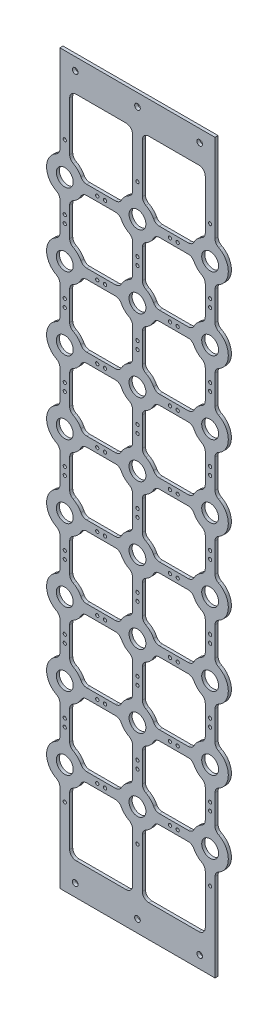
from build123d import *

# Parameters (mm, degrees)
SKETCH1_W           = 282
SKETCH1_H           = 1122
BOSS_EXTRUDE1_DEPTH = 4.7625
CUT_EXTRUDE1_DEPTH  = 579.467528394
CUT_EXTRUDE2_DEPTH  = 579.467528394
CUT_EXTRUDE3_DEPTH  = 579.467528394
CUT_EXTRUDE4_DEPTH  = 579.467528394
CUT_EXTRUDE5_DEPTH  = 579.467528394
CUT_EXTRUDE6_DEPTH  = 579.467528394
CUT_EXTRUDE7_DEPTH  = 579.467528394
CUT_EXTRUDE8_DEPTH  = 579.467528394
CUT_EXTRUDE9_DEPTH  = 579.467528394
CUT_EXTRUDE10_DEPTH = 579.467528394
CUT_EXTRUDE11_DEPTH = 579.467528394
CUT_EXTRUDE12_DEPTH = 579.467528394
CUT_EXTRUDE13_DEPTH = 579.467528394
CUT_EXTRUDE14_DEPTH = 579.467528394
CUT_EXTRUDE15_DEPTH = 579.467528394
CUT_EXTRUDE16_DEPTH = 579.467528394
CUT_EXTRUDE17_DEPTH = 579.467528394
CUT_EXTRUDE18_DEPTH = 579.467528394
CUT_EXTRUDE19_DEPTH = 579.467528394
CUT_EXTRUDE20_DEPTH = 579.467528394
FILLET1_R           = 10
SKETCH26_R          = 2.4892
CUT_EXTRUDE21_DEPTH = 10
SKETCH28_R          = 13
CUT_EXTRUDE23_DEPTH = 10
SKETCH27_R          = 4.3688
CUT_EXTRUDE22_DEPTH = 579.467528394
CUT_EXTRUDE24_DEPTH = 10
CUT_EXTRUDE25_DEPTH = 10


with BuildPart() as part:
    # Sketch1 → Boss-Extrude1 (new body)
    with BuildSketch(Plane.XY.offset(1.5875)):
        Rectangle(SKETCH1_W, SKETCH1_H)
    extrude(amount=-BOSS_EXTRUDE1_DEPTH)

    # Sketch2 → Cut-Extrude1 (cut, through all)
    with BuildSketch(Plane(origin=(0, 0, -3.175), x_dir=(-1, 0, 0), z_dir=(0, 0, -1))):
        with BuildLine():
            Line((141, 511.5), (119.5, 511.5))
            Line((119.5, 511.5), (119.5, 418.98722105))
            ThreePointArc((119.5, 418.98722105), (140.01, 392), (119.5, 365.01277895))
            Line((119.5, 365.01277895), (119.5, 306.98722105))
            ThreePointArc((119.5, 306.98722105), (140.01, 280), (119.5, 253.01277895))
            Line((119.5, 253.01277895), (119.5, 194.98722105))
            ThreePointArc((119.5, 194.98722105), (140.01, 168), (119.5, 141.01277895))
            Line((119.5, 141.01277895), (119.5, 82.98722105))
            ThreePointArc((119.5, 82.98722105), (140.01, 56), (119.5, 29.01277895))
            Line((119.5, 29.01277895), (119.5, -29.01277895))
            ThreePointArc((119.5, -29.01277895), (140.01, -56), (119.5, -82.98722105))
            Line((119.5, -82.98722105), (119.5, -141.01277895))
            ThreePointArc((119.5, -141.01277895), (140.01, -168), (119.5, -194.98722105))
            Line((119.5, -194.98722105), (119.5, -253.01277895))
            ThreePointArc((119.5, -253.01277895), (140.01, -280), (119.5, -306.98722105))
            Line((119.5, -306.98722105), (119.5, -365.01277895))
            ThreePointArc((119.5, -365.01277895), (140.01, -392), (119.5, -418.98722105))
            Line((119.5, -418.98722105), (119.5, -511.5))
            Line((119.5, -511.5), (141, -511.5))
            Line((141, -511.5), (141, 511.5))
        make_face()
    extrude(amount=-CUT_EXTRUDE1_DEPTH, mode=Mode.SUBTRACT)

    # Sketch3 → Cut-Extrude2 (cut, through all)
    with BuildSketch(Plane(origin=(0, 0, -3.175), x_dir=(-1, 0, 0), z_dir=(0, 0, -1))):
        with BuildLine():
            Line((-141, 511.5), (-141, -511.5))
            Line((-141, -511.5), (-119.5, -511.5))
            Line((-119.5, -511.5), (-119.5, -418.98722105))
            ThreePointArc((-119.5, -418.98722105), (-140.01, -392), (-119.5, -365.01277895))
            Line((-119.5, -365.01277895), (-119.5, -306.98722105))
            ThreePointArc((-119.5, -306.98722105), (-140.01, -280), (-119.5, -253.01277895))
            Line((-119.5, -253.01277895), (-119.5, -194.98722105))
            ThreePointArc((-119.5, -194.98722105), (-140.01, -168), (-119.5, -141.01277895))
            Line((-119.5, -141.01277895), (-119.5, -82.98722105))
            ThreePointArc((-119.5, -82.98722105), (-140.01, -56), (-119.5, -29.01277895))
            Line((-119.5, -29.01277895), (-119.5, 29.01277895))
            ThreePointArc((-119.5, 29.01277895), (-140.01, 56), (-119.5, 82.98722105))
            Line((-119.5, 82.98722105), (-119.5, 141.01277895))
            ThreePointArc((-119.5, 141.01277895), (-140.01, 168), (-119.5, 194.98722105))
            Line((-119.5, 194.98722105), (-119.5, 253.01277895))
            ThreePointArc((-119.5, 253.01277895), (-140.01, 280), (-119.5, 306.98722105))
            Line((-119.5, 306.98722105), (-119.5, 365.01277895))
            ThreePointArc((-119.5, 365.01277895), (-140.01, 392), (-119.5, 418.98722105))
            Line((-119.5, 418.98722105), (-119.5, 511.5))
            Line((-119.5, 511.5), (-141, 511.5))
        make_face()
    extrude(amount=-CUT_EXTRUDE2_DEPTH, mode=Mode.SUBTRACT)

    # Sketch4 → Cut-Extrude3 (cut, through all)
    with BuildSketch(Plane.XY.offset(1.5875)):
        with BuildLine():
            Line((-26.98722105, -399.5), (-85.01277895, -399.5))
            ThreePointArc((-85.01277895, -399.5), (-92.193939059, -411.806060941), (-104.5, -418.98722105))
            Line((-104.5, -418.98722105), (-104.5, -511.5))
            Line((-104.5, -511.5), (-7.5, -511.5))
            Line((-7.5, -511.5), (-7.5, -418.98722105))
            ThreePointArc((-7.5, -418.98722105), (-19.806060941, -411.806060941), (-26.98722105, -399.5))
        make_face()
    extrude(amount=-CUT_EXTRUDE3_DEPTH, mode=Mode.SUBTRACT)

    # Sketch5 → Cut-Extrude4 (cut, through all)
    with BuildSketch(Plane.XY.offset(1.5875)):
        with BuildLine():
            Line((-85.01277895, 287.5), (-26.98722105, 287.5))
            ThreePointArc((-26.98722105, 287.5), (-19.806060941, 299.806060941), (-7.5, 306.98722105))
            Line((-7.5, 306.98722105), (-7.5, 365.01277895))
            ThreePointArc((-7.5, 365.01277895), (-19.806060941, 372.193939059), (-26.98722105, 384.5))
            Line((-26.98722105, 384.5), (-85.01277895, 384.5))
            ThreePointArc((-85.01277895, 384.5), (-92.193939059, 372.193939059), (-104.5, 365.01277895))
            Line((-104.5, 365.01277895), (-104.5, 306.98722105))
            ThreePointArc((-104.5, 306.98722105), (-92.193939059, 299.806060941), (-85.01277895, 287.5))
        make_face()
    extrude(amount=-CUT_EXTRUDE4_DEPTH, mode=Mode.SUBTRACT)

    # Sketch6 → Cut-Extrude5 (cut, through all)
    with BuildSketch(Plane.XY.offset(1.5875)):
        with BuildLine():
            Line((26.98722105, -384.5), (85.01277895, -384.5))
            ThreePointArc((85.01277895, -384.5), (92.193939059, -372.193939059), (104.5, -365.01277895))
            Line((104.5, -365.01277895), (104.5, -306.98722105))
            ThreePointArc((104.5, -306.98722105), (92.193939059, -299.806060941), (85.01277895, -287.5))
            Line((85.01277895, -287.5), (26.98722105, -287.5))
            ThreePointArc((26.98722105, -287.5), (19.806060941, -299.806060941), (7.5, -306.98722105))
            Line((7.5, -306.98722105), (7.5, -365.01277895))
            ThreePointArc((7.5, -365.01277895), (19.806060941, -372.193939059), (26.98722105, -384.5))
        make_face()
    extrude(amount=-CUT_EXTRUDE5_DEPTH, mode=Mode.SUBTRACT)

    # Sketch7 → Cut-Extrude6 (cut, through all)
    with BuildSketch(Plane.XY.offset(1.5875)):
        with BuildLine():
            Line((26.98722105, -272.5), (85.01277895, -272.5))
            ThreePointArc((85.01277895, -272.5), (92.193939059, -260.193939059), (104.5, -253.01277895))
            Line((104.5, -253.01277895), (104.5, -194.98722105))
            ThreePointArc((104.5, -194.98722105), (92.193939059, -187.806060941), (85.01277895, -175.5))
            Line((85.01277895, -175.5), (26.98722105, -175.5))
            ThreePointArc((26.98722105, -175.5), (19.806060941, -187.806060941), (7.5, -194.98722105))
            Line((7.5, -194.98722105), (7.5, -253.01277895))
            ThreePointArc((7.5, -253.01277895), (19.806060941, -260.193939059), (26.98722105, -272.5))
        make_face()
    extrude(amount=-CUT_EXTRUDE6_DEPTH, mode=Mode.SUBTRACT)

    # Sketch8 → Cut-Extrude7 (cut, through all)
    with BuildSketch(Plane.XY.offset(1.5875)):
        with BuildLine():
            Line((26.98722105, -160.5), (85.01277895, -160.5))
            ThreePointArc((85.01277895, -160.5), (92.193939059, -148.193939059), (104.5, -141.01277895))
            Line((104.5, -141.01277895), (104.5, -82.98722105))
            ThreePointArc((104.5, -82.98722105), (92.193939059, -75.806060941), (85.01277895, -63.5))
            Line((85.01277895, -63.5), (26.98722105, -63.5))
            ThreePointArc((26.98722105, -63.5), (19.806060941, -75.806060941), (7.5, -82.98722105))
            Line((7.5, -82.98722105), (7.5, -141.01277895))
            ThreePointArc((7.5, -141.01277895), (19.806060941, -148.193939059), (26.98722105, -160.5))
        make_face()
    extrude(amount=-CUT_EXTRUDE7_DEPTH, mode=Mode.SUBTRACT)

    # Sketch9 → Cut-Extrude8 (cut, through all)
    with BuildSketch(Plane.XY.offset(1.5875)):
        with BuildLine():
            Line((-85.01277895, 175.5), (-26.98722105, 175.5))
            ThreePointArc((-26.98722105, 175.5), (-19.806060941, 187.806060941), (-7.5, 194.98722105))
            Line((-7.5, 194.98722105), (-7.5, 253.01277895))
            ThreePointArc((-7.5, 253.01277895), (-19.806060941, 260.193939059), (-26.98722105, 272.5))
            Line((-26.98722105, 272.5), (-85.01277895, 272.5))
            ThreePointArc((-85.01277895, 272.5), (-92.193939059, 260.193939059), (-104.5, 253.01277895))
            Line((-104.5, 253.01277895), (-104.5, 194.98722105))
            ThreePointArc((-104.5, 194.98722105), (-92.193939059, 187.806060941), (-85.01277895, 175.5))
        make_face()
    extrude(amount=-CUT_EXTRUDE8_DEPTH, mode=Mode.SUBTRACT)

    # Sketch10 → Cut-Extrude9 (cut, through all)
    with BuildSketch(Plane.XY.offset(1.5875)):
        with BuildLine():
            Line((-85.01277895, 63.5), (-26.98722105, 63.5))
            ThreePointArc((-26.98722105, 63.5), (-19.806060941, 75.806060941), (-7.5, 82.98722105))
            Line((-7.5, 82.98722105), (-7.5, 141.01277895))
            ThreePointArc((-7.5, 141.01277895), (-19.806060941, 148.193939059), (-26.98722105, 160.5))
            Line((-26.98722105, 160.5), (-85.01277895, 160.5))
            ThreePointArc((-85.01277895, 160.5), (-92.193939059, 148.193939059), (-104.5, 141.01277895))
            Line((-104.5, 141.01277895), (-104.5, 82.98722105))
            ThreePointArc((-104.5, 82.98722105), (-92.193939059, 75.806060941), (-85.01277895, 63.5))
        make_face()
    extrude(amount=-CUT_EXTRUDE9_DEPTH, mode=Mode.SUBTRACT)

    # Sketch11 → Cut-Extrude10 (cut, through all)
    with BuildSketch(Plane.XY.offset(1.5875)):
        with BuildLine():
            Line((-85.01277895, -48.5), (-26.98722105, -48.5))
            ThreePointArc((-26.98722105, -48.5), (-19.806060941, -36.193939059), (-7.5, -29.01277895))
            Line((-7.5, -29.01277895), (-7.5, 29.01277895))
            ThreePointArc((-7.5, 29.01277895), (-19.806060941, 36.193939059), (-26.98722105, 48.5))
            Line((-26.98722105, 48.5), (-85.01277895, 48.5))
            ThreePointArc((-85.01277895, 48.5), (-92.193939059, 36.193939059), (-104.5, 29.01277895))
            Line((-104.5, 29.01277895), (-104.5, -29.01277895))
            ThreePointArc((-104.5, -29.01277895), (-92.193939059, -36.193939059), (-85.01277895, -48.5))
        make_face()
    extrude(amount=-CUT_EXTRUDE10_DEPTH, mode=Mode.SUBTRACT)

    # Sketch12 → Cut-Extrude11 (cut, through all)
    with BuildSketch(Plane.XY.offset(1.5875)):
        with BuildLine():
            Line((-85.01277895, -160.5), (-26.98722105, -160.5))
            ThreePointArc((-26.98722105, -160.5), (-19.806060941, -148.193939059), (-7.5, -141.01277895))
            Line((-7.5, -141.01277895), (-7.5, -82.98722105))
            ThreePointArc((-7.5, -82.98722105), (-19.806060941, -75.806060941), (-26.98722105, -63.5))
            Line((-26.98722105, -63.5), (-85.01277895, -63.5))
            ThreePointArc((-85.01277895, -63.5), (-92.193939059, -75.806060941), (-104.5, -82.98722105))
            Line((-104.5, -82.98722105), (-104.5, -141.01277895))
            ThreePointArc((-104.5, -141.01277895), (-92.193939059, -148.193939059), (-85.01277895, -160.5))
        make_face()
    extrude(amount=-CUT_EXTRUDE11_DEPTH, mode=Mode.SUBTRACT)

    # Sketch13 → Cut-Extrude12 (cut, through all)
    with BuildSketch(Plane.XY.offset(1.5875)):
        with BuildLine():
            Line((26.98722105, -48.5), (85.01277895, -48.5))
            ThreePointArc((85.01277895, -48.5), (92.193939059, -36.193939059), (104.5, -29.01277895))
            Line((104.5, -29.01277895), (104.5, 29.01277895))
            ThreePointArc((104.5, 29.01277895), (92.193939059, 36.193939059), (85.01277895, 48.5))
            Line((85.01277895, 48.5), (26.98722105, 48.5))
            ThreePointArc((26.98722105, 48.5), (19.806060941, 36.193939059), (7.5, 29.01277895))
            Line((7.5, 29.01277895), (7.5, -29.01277895))
            ThreePointArc((7.5, -29.01277895), (19.806060941, -36.193939059), (26.98722105, -48.5))
        make_face()
    extrude(amount=-CUT_EXTRUDE12_DEPTH, mode=Mode.SUBTRACT)

    # Sketch14 → Cut-Extrude13 (cut, through all)
    with BuildSketch(Plane.XY.offset(1.5875)):
        with BuildLine():
            Line((26.98722105, 63.5), (85.01277895, 63.5))
            ThreePointArc((85.01277895, 63.5), (92.193939059, 75.806060941), (104.5, 82.98722105))
            Line((104.5, 82.98722105), (104.5, 141.01277895))
            ThreePointArc((104.5, 141.01277895), (92.193939059, 148.193939059), (85.01277895, 160.5))
            Line((85.01277895, 160.5), (26.98722105, 160.5))
            ThreePointArc((26.98722105, 160.5), (19.806060941, 148.193939059), (7.5, 141.01277895))
            Line((7.5, 141.01277895), (7.5, 82.98722105))
            ThreePointArc((7.5, 82.98722105), (19.806060941, 75.806060941), (26.98722105, 63.5))
        make_face()
    extrude(amount=-CUT_EXTRUDE13_DEPTH, mode=Mode.SUBTRACT)

    # Sketch15 → Cut-Extrude14 (cut, through all)
    with BuildSketch(Plane.XY.offset(1.5875)):
        with BuildLine():
            Line((26.98722105, 175.5), (85.01277895, 175.5))
            ThreePointArc((85.01277895, 175.5), (92.193939059, 187.806060941), (104.5, 194.98722105))
            Line((104.5, 194.98722105), (104.5, 253.01277895))
            ThreePointArc((104.5, 253.01277895), (92.193939059, 260.193939059), (85.01277895, 272.5))
            Line((85.01277895, 272.5), (26.98722105, 272.5))
            ThreePointArc((26.98722105, 272.5), (19.806060941, 260.193939059), (7.5, 253.01277895))
            Line((7.5, 253.01277895), (7.5, 194.98722105))
            ThreePointArc((7.5, 194.98722105), (19.806060941, 187.806060941), (26.98722105, 175.5))
        make_face()
    extrude(amount=-CUT_EXTRUDE14_DEPTH, mode=Mode.SUBTRACT)

    # Sketch16 → Cut-Extrude15 (cut, through all)
    with BuildSketch(Plane.XY.offset(1.5875)):
        with BuildLine():
            Line((26.98722105, 287.5), (85.01277895, 287.5))
            ThreePointArc((85.01277895, 287.5), (92.193939059, 299.806060941), (104.5, 306.98722105))
            Line((104.5, 306.98722105), (104.5, 365.01277895))
            ThreePointArc((104.5, 365.01277895), (92.193939059, 372.193939059), (85.01277895, 384.5))
            Line((85.01277895, 384.5), (26.98722105, 384.5))
            ThreePointArc((26.98722105, 384.5), (19.806060941, 372.193939059), (7.5, 365.01277895))
            Line((7.5, 365.01277895), (7.5, 306.98722105))
            ThreePointArc((7.5, 306.98722105), (19.806060941, 299.806060941), (26.98722105, 287.5))
        make_face()
    extrude(amount=-CUT_EXTRUDE15_DEPTH, mode=Mode.SUBTRACT)

    # Sketch17 → Cut-Extrude16 (cut, through all)
    with BuildSketch(Plane.XY.offset(1.5875)):
        with BuildLine():
            Line((-85.01277895, -272.5), (-26.98722105, -272.5))
            ThreePointArc((-26.98722105, -272.5), (-19.806060941, -260.193939059), (-7.5, -253.01277895))
            Line((-7.5, -253.01277895), (-7.5, -194.98722105))
            ThreePointArc((-7.5, -194.98722105), (-19.806060941, -187.806060941), (-26.98722105, -175.5))
            Line((-26.98722105, -175.5), (-85.01277895, -175.5))
            ThreePointArc((-85.01277895, -175.5), (-92.193939059, -187.806060941), (-104.5, -194.98722105))
            Line((-104.5, -194.98722105), (-104.5, -253.01277895))
            ThreePointArc((-104.5, -253.01277895), (-92.193939059, -260.193939059), (-85.01277895, -272.5))
        make_face()
    extrude(amount=-CUT_EXTRUDE16_DEPTH, mode=Mode.SUBTRACT)

    # Sketch18 → Cut-Extrude17 (cut, through all)
    with BuildSketch(Plane.XY.offset(1.5875)):
        with BuildLine():
            Line((-85.01277895, -384.5), (-26.98722105, -384.5))
            ThreePointArc((-26.98722105, -384.5), (-19.806060941, -372.193939059), (-7.5, -365.01277895))
            Line((-7.5, -365.01277895), (-7.5, -306.98722105))
            ThreePointArc((-7.5, -306.98722105), (-19.806060941, -299.806060941), (-26.98722105, -287.5))
            Line((-26.98722105, -287.5), (-85.01277895, -287.5))
            ThreePointArc((-85.01277895, -287.5), (-92.193939059, -299.806060941), (-104.5, -306.98722105))
            Line((-104.5, -306.98722105), (-104.5, -365.01277895))
            ThreePointArc((-104.5, -365.01277895), (-92.193939059, -372.193939059), (-85.01277895, -384.5))
        make_face()
    extrude(amount=-CUT_EXTRUDE17_DEPTH, mode=Mode.SUBTRACT)

    # Sketch19 → Cut-Extrude18 (cut, through all)
    with BuildSketch(Plane.XY.offset(1.5875)):
        with BuildLine():
            Line((-85.01277895, 399.5), (-26.98722105, 399.5))
            ThreePointArc((-26.98722105, 399.5), (-19.806060941, 411.806060941), (-7.5, 418.98722105))
            Line((-7.5, 418.98722105), (-7.5, 511.5))
            Line((-7.5, 511.5), (-104.5, 511.5))
            Line((-104.5, 511.5), (-104.5, 418.98722105))
            ThreePointArc((-104.5, 418.98722105), (-92.193939059, 411.806060941), (-85.01277895, 399.5))
        make_face()
    extrude(amount=-CUT_EXTRUDE18_DEPTH, mode=Mode.SUBTRACT)

    # Sketch20 → Cut-Extrude19 (cut, through all)
    with BuildSketch(Plane.XY.offset(1.5875)):
        with BuildLine():
            Line((7.5, -418.98722105), (7.5, -511.5))
            Line((7.5, -511.5), (104.5, -511.5))
            Line((104.5, -511.5), (104.5, -418.98722105))
            ThreePointArc((104.5, -418.98722105), (92.193939059, -411.806060941), (85.01277895, -399.5))
            Line((85.01277895, -399.5), (26.98722105, -399.5))
            ThreePointArc((26.98722105, -399.5), (19.806060941, -411.806060941), (7.5, -418.98722105))
        make_face()
    extrude(amount=-CUT_EXTRUDE19_DEPTH, mode=Mode.SUBTRACT)

    # Sketch21 → Cut-Extrude20 (cut, through all)
    with BuildSketch(Plane(origin=(0, 0, -3.175), x_dir=(-1, 0, 0), z_dir=(0, 0, -1))):
        with BuildLine():
            Line((-7.5, 418.98722105), (-7.5, 511.5))
            Line((-7.5, 511.5), (-104.5, 511.5))
            Line((-104.5, 511.5), (-104.5, 418.98722105))
            ThreePointArc((-104.5, 418.98722105), (-92.193939059, 411.806060941), (-85.01277895, 399.5))
            Line((-85.01277895, 399.5), (-26.98722105, 399.5))
            ThreePointArc((-26.98722105, 399.5), (-19.806060941, 411.806060941), (-7.5, 418.98722105))
        make_face()
    extrude(amount=-CUT_EXTRUDE20_DEPTH, mode=Mode.SUBTRACT)

    # Fillet1
    fillet1_edges = [part.edges().sort_by_distance(p)[0] for p in [
        (-26.98722105, -399.5, -0.79375),
        (26.98722105, 175.5, -0.79375),
        (119.5, 418.98722105, -0.79375),
        (104.5, 418.98722105, -0.79375),
        (-85.01277895, -272.5, -0.79375),
        (104.5, 511.5, -0.79375),
        (-119.5, -194.98722105, -0.79375),
        (7.5, 511.5, -0.79375),
        (119.5, -511.5, -0.79375),
        (7.5, 418.98722105, -0.79375),
        (26.98722105, 287.5, -0.79375),
        (26.98722105, 399.5, -0.79375),
        (-85.01277895, -384.5, -0.79375),
        (-7.5, 511.5, -0.79375),
        (104.5, -511.5, -0.79375),
        (-104.5, 511.5, -0.79375),
        (-119.5, 253.01277895, -0.79375),
        (-104.5, 418.98722105, -0.79375),
        (119.5, -29.01277895, -0.79375),
        (-85.01277895, 399.5, -0.79375),
        (85.01277895, 160.5, -0.79375),
        (-26.98722105, 399.5, -0.79375),
        (85.01277895, 272.5, -0.79375),
        (-7.5, 418.98722105, -0.79375),
        (85.01277895, 384.5, -0.79375),
        (-85.01277895, 384.5, -0.79375),
        (-26.98722105, -175.5, -0.79375),
        (-104.5, 365.01277895, -0.79375),
        (-26.98722105, -287.5, -0.79375),
        (-104.5, 306.98722105, -0.79375),
        (85.01277895, -399.5, -0.79375),
        (-85.01277895, 287.5, -0.79375),
        (-119.5, -418.98722105, -0.79375),
        (-26.98722105, 287.5, -0.79375),
        (-119.5, 29.01277895, -0.79375),
        (-7.5, 306.98722105, -0.79375),
        (-119.5, 511.5, -0.79375),
        (-7.5, 365.01277895, -0.79375),
        (119.5, 194.98722105, -0.79375),
        (-26.98722105, 384.5, -0.79375),
        (119.5, -253.01277895, -0.79375),
        (26.98722105, -287.5, -0.79375),
        (104.5, 82.98722105, -0.79375),
        (7.5, -306.98722105, -0.79375),
        (7.5, 253.01277895, -0.79375),
        (7.5, -365.01277895, -0.79375),
        (104.5, 194.98722105, -0.79375),
        (26.98722105, -384.5, -0.79375),
        (7.5, 365.01277895, -0.79375),
        (85.01277895, -384.5, -0.79375),
        (104.5, 306.98722105, -0.79375),
        (104.5, -365.01277895, -0.79375),
        (-104.5, -194.98722105, -0.79375),
        (104.5, -306.98722105, -0.79375),
        (-7.5, -253.01277895, -0.79375),
        (85.01277895, -287.5, -0.79375),
        (-104.5, -306.98722105, -0.79375),
        (26.98722105, -175.5, -0.79375),
        (-7.5, -365.01277895, -0.79375),
        (7.5, -194.98722105, -0.79375),
        (-7.5, -511.5, -0.79375),
        (7.5, -253.01277895, -0.79375),
        (-104.5, -418.98722105, -0.79375),
        (26.98722105, -272.5, -0.79375),
        (7.5, -418.98722105, -0.79375),
        (85.01277895, -272.5, -0.79375),
        (-141, -511.5, -0.79375),
        (104.5, -253.01277895, -0.79375),
        (-119.5, -306.98722105, -0.79375),
        (104.5, -194.98722105, -0.79375),
        (-119.5, -82.98722105, -0.79375),
        (85.01277895, -175.5, -0.79375),
        (-119.5, 141.01277895, -0.79375),
        (26.98722105, -63.5, -0.79375),
        (-119.5, 365.01277895, -0.79375),
        (7.5, -82.98722105, -0.79375),
        (141, 511.5, -0.79375),
        (7.5, -141.01277895, -0.79375),
        (119.5, 306.98722105, -0.79375),
        (26.98722105, -160.5, -0.79375),
        (119.5, 82.98722105, -0.79375),
        (85.01277895, -160.5, -0.79375),
        (119.5, -141.01277895, -0.79375),
        (104.5, -141.01277895, -0.79375),
        (119.5, -365.01277895, -0.79375),
        (104.5, -82.98722105, -0.79375),
        (85.01277895, 63.5, -0.79375),
        (85.01277895, -63.5, -0.79375),
        (104.5, 141.01277895, -0.79375),
        (-85.01277895, 272.5, -0.79375),
        (26.98722105, 272.5, -0.79375),
        (-104.5, 253.01277895, -0.79375),
        (7.5, 194.98722105, -0.79375),
        (-104.5, 194.98722105, -0.79375),
        (85.01277895, 175.5, -0.79375),
        (-85.01277895, 175.5, -0.79375),
        (104.5, 253.01277895, -0.79375),
        (-26.98722105, 175.5, -0.79375),
        (26.98722105, 384.5, -0.79375),
        (-7.5, 194.98722105, -0.79375),
        (7.5, 306.98722105, -0.79375),
        (-7.5, 253.01277895, -0.79375),
        (85.01277895, 287.5, -0.79375),
        (-26.98722105, 272.5, -0.79375),
        (104.5, 365.01277895, -0.79375),
        (-85.01277895, 160.5, -0.79375),
        (-85.01277895, -175.5, -0.79375),
        (-104.5, 141.01277895, -0.79375),
        (-104.5, -253.01277895, -0.79375),
        (-104.5, 82.98722105, -0.79375),
        (-26.98722105, -272.5, -0.79375),
        (-85.01277895, 63.5, -0.79375),
        (-7.5, -194.98722105, -0.79375),
        (-26.98722105, 63.5, -0.79375),
        (-85.01277895, -287.5, -0.79375),
        (-7.5, 82.98722105, -0.79375),
        (-104.5, -365.01277895, -0.79375),
        (-7.5, 141.01277895, -0.79375),
        (-26.98722105, -384.5, -0.79375),
        (-26.98722105, 160.5, -0.79375),
        (-7.5, -306.98722105, -0.79375),
        (-85.01277895, 48.5, -0.79375),
        (-104.5, -511.5, -0.79375),
        (-104.5, 29.01277895, -0.79375),
        (-7.5, -418.98722105, -0.79375),
        (-104.5, -29.01277895, -0.79375),
        (-85.01277895, -399.5, -0.79375),
        (-85.01277895, -48.5, -0.79375),
        (104.5, -418.98722105, -0.79375),
        (-26.98722105, -48.5, -0.79375),
        (26.98722105, -399.5, -0.79375),
        (-7.5, -29.01277895, -0.79375),
        (7.5, -511.5, -0.79375),
        (-7.5, 29.01277895, -0.79375),
        (141, -511.5, -0.79375),
        (-26.98722105, 48.5, -0.79375),
        (-119.5, -511.5, -0.79375),
        (-85.01277895, -63.5, -0.79375),
        (-119.5, -365.01277895, -0.79375),
        (-104.5, -82.98722105, -0.79375),
        (-119.5, -253.01277895, -0.79375),
        (-104.5, -141.01277895, -0.79375),
        (-119.5, -141.01277895, -0.79375),
        (-85.01277895, -160.5, -0.79375),
        (-119.5, -29.01277895, -0.79375),
        (-26.98722105, -160.5, -0.79375),
        (-119.5, 82.98722105, -0.79375),
        (-7.5, -141.01277895, -0.79375),
        (-119.5, 194.98722105, -0.79375),
        (-7.5, -82.98722105, -0.79375),
        (-119.5, 306.98722105, -0.79375),
        (-26.98722105, -63.5, -0.79375),
        (-119.5, 418.98722105, -0.79375),
        (26.98722105, 48.5, -0.79375),
        (-141, 511.5, -0.79375),
        (7.5, 29.01277895, -0.79375),
        (119.5, 511.5, -0.79375),
        (7.5, -29.01277895, -0.79375),
        (119.5, 365.01277895, -0.79375),
        (26.98722105, -48.5, -0.79375),
        (119.5, 253.01277895, -0.79375),
        (85.01277895, -48.5, -0.79375),
        (119.5, 141.01277895, -0.79375),
        (104.5, -29.01277895, -0.79375),
        (119.5, 29.01277895, -0.79375),
        (104.5, 29.01277895, -0.79375),
        (119.5, -82.98722105, -0.79375),
        (85.01277895, 48.5, -0.79375),
        (119.5, -194.98722105, -0.79375),
        (26.98722105, 160.5, -0.79375),
        (119.5, -306.98722105, -0.79375),
        (7.5, 141.01277895, -0.79375),
        (119.5, -418.98722105, -0.79375),
        (7.5, 82.98722105, -0.79375),
        (85.01277895, 399.5, -0.79375),
        (26.98722105, 63.5, -0.79375),
    ]]
    fillet(fillet1_edges, radius=FILLET1_R)

    # Sketch26 → Cut-Extrude21 (cut)
    with BuildSketch(Plane.XY.offset(1.5875)):
        with Locations((-112, 442)):
            Circle(SKETCH26_R)
        with Locations((0, 442)):
            Circle(SKETCH26_R)
        with Locations((112, 442)):
            Circle(SKETCH26_R)
        with Locations((-112, 342)):
            Circle(SKETCH26_R)
        with Locations((0, 342)):
            Circle(SKETCH26_R)
        with Locations((112, 342)):
            Circle(SKETCH26_R)
        with Locations((-112, 330)):
            Circle(SKETCH26_R)
        with Locations((0, 330)):
            Circle(SKETCH26_R)
        with Locations((112, 330)):
            Circle(SKETCH26_R)
        with Locations((0, 230)):
            Circle(SKETCH26_R)
        with Locations((-112, 230)):
            Circle(SKETCH26_R)
        with Locations((112, 230)):
            Circle(SKETCH26_R)
        with Locations((-112, 218)):
            Circle(SKETCH26_R)
        with Locations((0, 218)):
            Circle(SKETCH26_R)
        with Locations((112, 218)):
            Circle(SKETCH26_R)
        with Locations((-112, 118)):
            Circle(SKETCH26_R)
        with Locations((0, 118)):
            Circle(SKETCH26_R)
        with Locations((112, 118)):
            Circle(SKETCH26_R)
        with Locations((-112, 106)):
            Circle(SKETCH26_R)
        with Locations((112, 106)):
            Circle(SKETCH26_R)
        with Locations((0, 106)):
            Circle(SKETCH26_R)
        with Locations((0, 6)):
            Circle(SKETCH26_R)
        with Locations((0, -6)):
            Circle(SKETCH26_R)
        with Locations((-112, 6)):
            Circle(SKETCH26_R)
        with Locations((112, 6)):
            Circle(SKETCH26_R)
        with Locations((-112, -6)):
            Circle(SKETCH26_R)
        with Locations((112, -6)):
            Circle(SKETCH26_R)
        with Locations((0, -218)):
            Circle(SKETCH26_R)
        with Locations((112, -218)):
            Circle(SKETCH26_R)
        with Locations((0, -230)):
            Circle(SKETCH26_R)
        with Locations((-112, -218)):
            Circle(SKETCH26_R)
        with Locations((-112, -230)):
            Circle(SKETCH26_R)
        with Locations((112, -230)):
            Circle(SKETCH26_R)
        with Locations((0, -118)):
            Circle(SKETCH26_R)
        with Locations((-112, -118)):
            Circle(SKETCH26_R)
        with Locations((112, -118)):
            Circle(SKETCH26_R)
        with Locations((0, -106)):
            Circle(SKETCH26_R)
        with Locations((-112, -106)):
            Circle(SKETCH26_R)
        with Locations((112, -106)):
            Circle(SKETCH26_R)
        with Locations((-112, -330)):
            Circle(SKETCH26_R)
        with Locations((0, -330)):
            Circle(SKETCH26_R)
        with Locations((112, -342)):
            Circle(SKETCH26_R)
        with Locations((112, -330)):
            Circle(SKETCH26_R)
        with Locations((0, -342)):
            Circle(SKETCH26_R)
        with Locations((-112, -342)):
            Circle(SKETCH26_R)
        with Locations((112, -442)):
            Circle(SKETCH26_R)
        with Locations((0, -442)):
            Circle(SKETCH26_R)
        with Locations((-112, -442)):
            Circle(SKETCH26_R)
        with Locations((-62, 392)):
            Circle(SKETCH26_R)
        with Locations((-50, 392)):
            Circle(SKETCH26_R)
        with Locations((50, 392)):
            Circle(SKETCH26_R)
        with Locations((62, 392)):
            Circle(SKETCH26_R)
        with Locations((62, 168)):
            Circle(SKETCH26_R)
        with Locations((-62, 168)):
            Circle(SKETCH26_R)
        with Locations((50, 168)):
            Circle(SKETCH26_R)
        with Locations((-50, 168)):
            Circle(SKETCH26_R)
        with Locations((-50, 280)):
            Circle(SKETCH26_R)
        with Locations((62, 280)):
            Circle(SKETCH26_R)
        with Locations((-62, 280)):
            Circle(SKETCH26_R)
        with Locations((50, 280)):
            Circle(SKETCH26_R)
        with Locations((62, 56)):
            Circle(SKETCH26_R)
        with Locations((-62, 56)):
            Circle(SKETCH26_R)
        with Locations((50, 56)):
            Circle(SKETCH26_R)
        with Locations((-50, 56)):
            Circle(SKETCH26_R)
        with Locations((62, -56)):
            Circle(SKETCH26_R)
        with Locations((-62, -56)):
            Circle(SKETCH26_R)
        with Locations((-50, -56)):
            Circle(SKETCH26_R)
        with Locations((50, -56)):
            Circle(SKETCH26_R)
        with Locations((62, -168)):
            Circle(SKETCH26_R)
        with Locations((-50, -168)):
            Circle(SKETCH26_R)
        with Locations((-62, -168)):
            Circle(SKETCH26_R)
        with Locations((50, -168)):
            Circle(SKETCH26_R)
        with Locations((-50, -280)):
            Circle(SKETCH26_R)
        with Locations((-62, -280)):
            Circle(SKETCH26_R)
        with Locations((62, -280)):
            Circle(SKETCH26_R)
        with Locations((50, -280)):
            Circle(SKETCH26_R)
        with Locations((-50, -392)):
            Circle(SKETCH26_R)
        with Locations((62, -392)):
            Circle(SKETCH26_R)
        with Locations((-62, -392)):
            Circle(SKETCH26_R)
        with Locations((50, -392)):
            Circle(SKETCH26_R)
    extrude(amount=-CUT_EXTRUDE21_DEPTH, mode=Mode.SUBTRACT)

    # Sketch28 → Cut-Extrude23 (cut)
    with BuildSketch(Plane.XY.offset(1.5875)):
        with Locations((-112, 392)):
            Circle(SKETCH28_R)
        with Locations((0, 392)):
            Circle(SKETCH28_R)
        with Locations((112, 392)):
            Circle(SKETCH28_R)
        with Locations((-112, 280)):
            Circle(SKETCH28_R)
        with Locations((0, 280)):
            Circle(SKETCH28_R)
        with Locations((112, 280)):
            Circle(SKETCH28_R)
        with Locations((-112, 168)):
            Circle(SKETCH28_R)
        with Locations((0, 168)):
            Circle(SKETCH28_R)
        with Locations((112, 168)):
            Circle(SKETCH28_R)
        with Locations((-112, 56)):
            Circle(SKETCH28_R)
        with Locations((0, 56)):
            Circle(SKETCH28_R)
        with Locations((112, 56)):
            Circle(SKETCH28_R)
        with Locations((-112, -56)):
            Circle(SKETCH28_R)
        with Locations((0, -56)):
            Circle(SKETCH28_R)
        with Locations((112, -56)):
            Circle(SKETCH28_R)
        with Locations((-112, -168)):
            Circle(SKETCH28_R)
        with Locations((0, -168)):
            Circle(SKETCH28_R)
        with Locations((112, -168)):
            Circle(SKETCH28_R)
        with Locations((-112, -280)):
            Circle(SKETCH28_R)
        with Locations((0, -280)):
            Circle(SKETCH28_R)
        with Locations((112, -280)):
            Circle(SKETCH28_R)
        with Locations((-112, -392)):
            Circle(SKETCH28_R)
        with Locations((0, -392)):
            Circle(SKETCH28_R)
        with Locations((112, -392)):
            Circle(SKETCH28_R)
    extrude(amount=-CUT_EXTRUDE23_DEPTH, mode=Mode.SUBTRACT)

    # Sketch27 → Cut-Extrude22 (cut, through all)
    with BuildSketch(Plane.XY.offset(1.5875)):
        with Locations((-95.95, 541.95)):
            Circle(SKETCH27_R)
        with Locations((0, 541.95)):
            Circle(SKETCH27_R)
        with Locations((95.95, 541.95)):
            Circle(SKETCH27_R)
        with Locations((-95.95, -541.95)):
            Circle(SKETCH27_R)
        with Locations((0, -541.95)):
            Circle(SKETCH27_R)
        with Locations((95.95, -541.95)):
            Circle(SKETCH27_R)
    extrude(amount=-CUT_EXTRUDE22_DEPTH, mode=Mode.SUBTRACT)

    # Sketch29 → Cut-Extrude24 (cut)
    with BuildSketch(Plane.XY.offset(1.5875)):
        with BuildLine():
            Line((-129.5, -511.5), (-131, -511.5))
            ThreePointArc((-131, -511.5), (-138.071067812, -514.428932188), (-141, -521.5))
            Line((-141, -521.5), (-141, -561))
            Line((-141, -561), (-119.5, -561))
            Line((-119.5, -561), (-119.5, -501.5))
            ThreePointArc((-119.5, -501.5), (-122.428932188, -508.571067812), (-129.5, -511.5))
        make_face()
        with BuildLine():
            Line((141, -561), (141, -521.5))
            ThreePointArc((141, -521.5), (138.071067812, -514.428932188), (131, -511.5))
            Line((131, -511.5), (129.5, -511.5))
            ThreePointArc((129.5, -511.5), (122.428932188, -508.571067812), (119.5, -501.5))
            Line((119.5, -501.5), (119.5, -561))
            Line((119.5, -561), (141, -561))
        make_face()
    extrude(amount=-CUT_EXTRUDE24_DEPTH, mode=Mode.SUBTRACT)

    # Sketch30 → Cut-Extrude25 (cut)
    with BuildSketch(Plane.XY.offset(1.5875)):
        with BuildLine():
            Line((141, 561), (119.5, 561))
            Line((119.5, 561), (119.5, 501.5))
            ThreePointArc((119.5, 501.5), (122.428932188, 508.571067812), (129.5, 511.5))
            Line((129.5, 511.5), (131, 511.5))
            ThreePointArc((131, 511.5), (138.071067812, 514.428932188), (141, 521.5))
            Line((141, 521.5), (141, 561))
        make_face()
        with BuildLine():
            Line((-141, 561), (-141, 521.5))
            ThreePointArc((-141, 521.5), (-138.071067812, 514.428932188), (-131, 511.5))
            Line((-131, 511.5), (-129.5, 511.5))
            ThreePointArc((-129.5, 511.5), (-122.428932188, 508.571067812), (-119.5, 501.5))
            Line((-119.5, 501.5), (-119.5, 561))
            Line((-119.5, 561), (-141, 561))
        make_face()
    extrude(amount=-CUT_EXTRUDE25_DEPTH, mode=Mode.SUBTRACT)


solid = part.part
